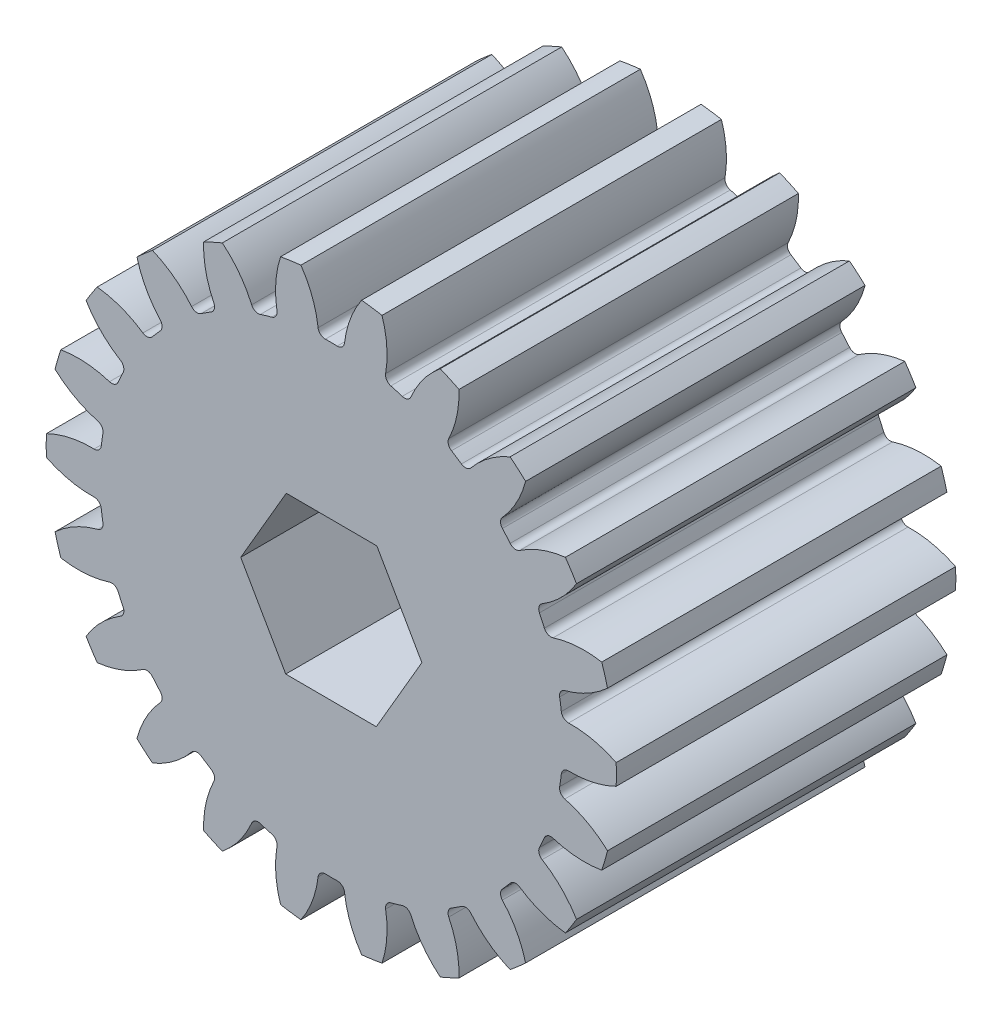
from build123d import *

# Parameters (mm, degrees)
BOSS_EXTRUDE1_DEPTH      = 25.4
BOSS_EXTRUDE1_DEPTH_BACK = 3.175
SKETCH1_R                = 24
CUT_EXTRUDE2_DEPTH       = 45.368126228
FILLET2_R                = 0.6
CIRPATTERN2_COUNT        = 22
FILLET2_OF_CIRPATTERN2_R = 0.6
CUT_EXTRUDE3_DEPTH       = 45.2944261


with BuildPart() as part:
    # Sketch1 → Boss-Extrude1 (new, two sides: drawn at the far end of the back side and taken through both)
    with BuildSketch(Plane.XY.offset(-BOSS_EXTRUDE1_DEPTH_BACK)):
        Circle(SKETCH1_R)
    extrude(amount=BOSS_EXTRUDE1_DEPTH + BOSS_EXTRUDE1_DEPTH_BACK)

    # Sketch3 → Cut-Extrude2 (cut, through all)
    with BuildSketch(Plane(origin=(0, 0, -3.175), x_dir=(-1, 0, 0), z_dir=(0, 0, -1))):
        with BuildLine():
            ThreePointArc((-3.283383383, 24.783449993), (-1.715772066, 22.318455925), (-1.06349074, 19.470978081))
            ThreePointArc((-1.06349074, 19.470978081), (0, 19.5), (1.06349074, 19.470978081))
            ThreePointArc((1.06349074, 19.470978081), (1.715772066, 22.318455925), (3.283383383, 24.783449993))
            ThreePointArc((3.283383383, 24.783449993), (0, 25), (-3.283383383, 24.783449993))
        make_face()
    cut_extrude2 = extrude(amount=-CUT_EXTRUDE2_DEPTH, mode=Mode.SUBTRACT)

    # Fillet2
    fillet2_edges = [part.edges().sort_by_distance(p)[0] for p in [
        (-1.06349074, 19.470978081, 11.1125),
        (1.06349074, 19.470978081, 11.1125),
    ]]
    fillet(fillet2_edges, radius=FILLET2_R)

    # CirPattern2: Cut-Extrude2 ×22 about axis
    cirpattern2_axis = Axis((0, 0, -3.175), (0, 0, 1))
    for i in range(1, CIRPATTERN2_COUNT):
        add(cut_extrude2.rotate(cirpattern2_axis, i * 360 / CIRPATTERN2_COUNT), mode=Mode.SUBTRACT)

    # Fillet2 of CirPattern2
    fillet2_of_cirpattern2_edges = [part.edges().sort_by_distance(p)[0] for p in [
        (-6.506020331, 18.382646693, 11.1125),
        (-4.465196547, 18.981886624, 11.1125),
        (-11.421470848, 15.805062596, 11.1125),
        (-9.632140165, 16.954995602, 11.1125),
        (-15.411621724, 11.947046323, 11.1125),
        (-14.018745071, 13.554511671, 11.1125),
        (-18.153214663, 7.121151409, 11.1125),
        (-17.269634624, 9.055921816, 11.1125),
        (-19.424142112, 1.718343159, 11.1125),
        (-19.121441087, 3.823675034, 11.1125),
        (-19.121441087, -3.823675034, 11.1125),
        (-19.424142112, -1.718343159, 11.1125),
        (-17.269634624, -9.055921816, 11.1125),
        (-18.153214663, -7.121151409, 11.1125),
        (-14.018745071, -13.554511671, 11.1125),
        (-15.411621724, -11.947046323, 11.1125),
        (-9.632140165, -16.954995602, 11.1125),
        (-11.421470848, -15.805062596, 11.1125),
        (-4.465196547, -18.981886624, 11.1125),
        (-6.506020331, -18.382646693, 11.1125),
        (1.06349074, -19.470978081, 11.1125),
        (-1.06349074, -19.470978081, 11.1125),
        (6.506020331, -18.382646693, 11.1125),
        (4.465196547, -18.981886624, 11.1125),
        (11.421470848, -15.805062596, 11.1125),
        (9.632140165, -16.954995602, 11.1125),
        (15.411621724, -11.947046323, 11.1125),
        (14.018745071, -13.554511671, 11.1125),
        (18.153214663, -7.121151409, 11.1125),
        (17.269634624, -9.055921816, 11.1125),
        (19.424142112, -1.718343159, 11.1125),
        (19.121441087, -3.823675034, 11.1125),
        (19.121441087, 3.823675034, 11.1125),
        (19.424142112, 1.718343159, 11.1125),
        (17.269634624, 9.055921816, 11.1125),
        (18.153214663, 7.121151409, 11.1125),
        (14.018745071, 13.554511671, 11.1125),
        (15.411621724, 11.947046323, 11.1125),
        (9.632140165, 16.954995602, 11.1125),
        (11.421470848, 15.805062596, 11.1125),
        (4.465196547, 18.981886624, 11.1125),
        (6.506020331, 18.382646693, 11.1125),
    ]]
    fillet(fillet2_of_cirpattern2_edges, radius=FILLET2_OF_CIRPATTERN2_R)

    # Sketch4 → Cut-Extrude3 (cut, through all)
    with BuildSketch(Plane.XY.offset(25.4)):
        Polygon((3.836203431, 6.590444945), (-3.789391029, 6.617472098), (-7.62559446, 0.027027153), (-3.836203431, -6.590444945), (3.789391029, -6.617472098), (7.62559446, -0.027027153), align=None)
    extrude(amount=-CUT_EXTRUDE3_DEPTH, mode=Mode.SUBTRACT)


solid = part.part
